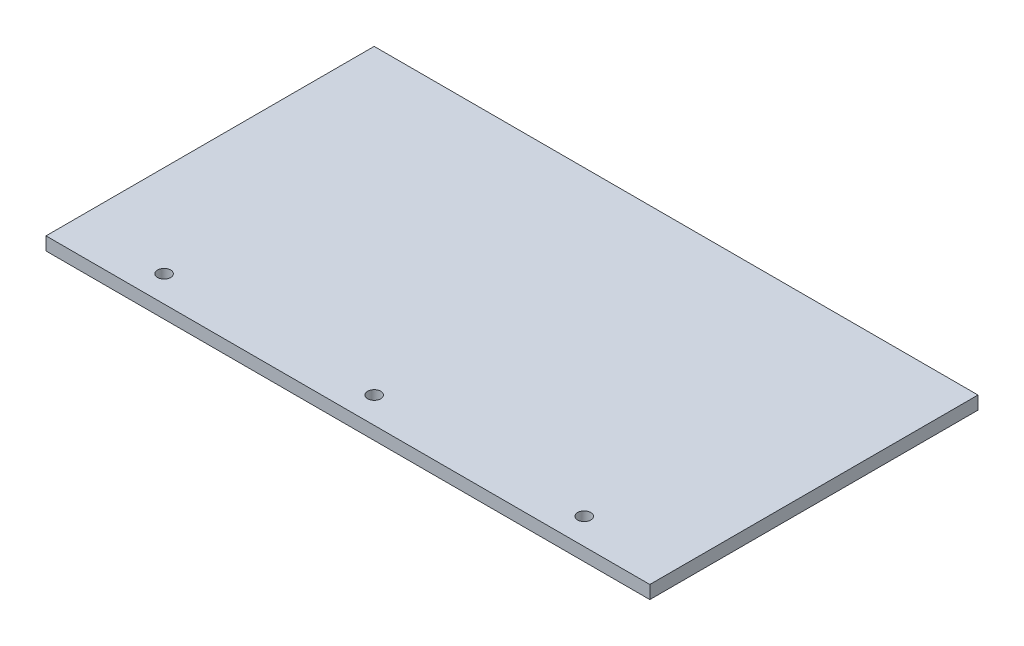
from build123d import *

# Parameters (mm, degrees)
SKETCH1_W           = 292.1
SKETCH1_H           = 158.75
BOSS_EXTRUDE1_DEPTH = 6.35
SKETCH2_R           = 3.175
CUT_EXTRUDE2_DEPTH  = 6.35


with BuildPart() as part:
    # Sketch1 → Boss-Extrude1 (new body)
    with BuildSketch(Plane(origin=(0, 0, 0), x_dir=(1, 0, 0), z_dir=(0, 1, 0))):
        with Locations((146.05, 79.375)):
            Rectangle(SKETCH1_W, SKETCH1_H)
    extrude(amount=BOSS_EXTRUDE1_DEPTH)

    # Sketch2 → Cut-Extrude2 (cut)
    with BuildSketch(Plane(origin=(0, 6.35, 0), x_dir=(1, 0, 0), z_dir=(0, 1, 0))):
        with Locations((146.05, 12.7)):
            Circle(SKETCH2_R)
        with Locations((247.65, 12.7)):
            Circle(SKETCH2_R)
        with Locations((44.45, 12.7)):
            Circle(SKETCH2_R)
    extrude(amount=-CUT_EXTRUDE2_DEPTH, mode=Mode.SUBTRACT)


solid = part.part
